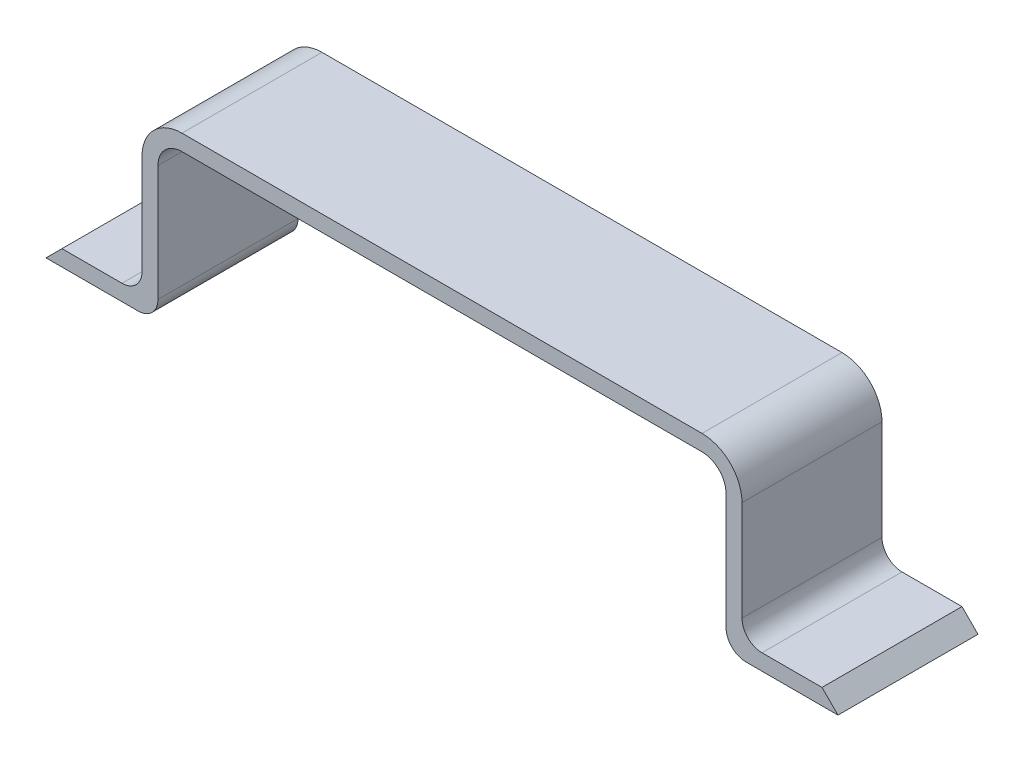
from build123d import *

# Parameters (mm, degrees)
BOSS_EXTRUDE1_DEPTH = 17.5
CHAMFER1_SIZE       = 5


with BuildPart() as part:
    # Sketch1 → Boss-Extrude1 (new, symmetric)
    with BuildSketch(Plane.XY):
        with BuildLine():
            Line((-100, 0), (-80, 0))
            ThreePointArc((-80, 0), (-76.464466094, 1.464466094), (-75, 5))
            Line((-75, 5), (-75, 30))
            ThreePointArc((-75, 30), (-72.071067812, 37.071067812), (-65, 40))
            Line((-65, 40), (65, 40))
            ThreePointArc((65, 40), (72.071067812, 37.071067812), (75, 30))
            Line((75, 30), (75, 5))
            ThreePointArc((75, 5), (76.464466094, 1.464466094), (80, 0))
            Line((80, 0), (100, 0))
            Line((100, 0), (100, -4))
            Line((100, -4), (76, -4))
            ThreePointArc((76, -4), (72.464466094, -2.535533906), (71, 1))
            Line((71, 1), (71, 30))
            ThreePointArc((71, 30), (69.242640687, 34.242640687), (65, 36))
            Line((65, 36), (-65, 36))
            ThreePointArc((-65, 36), (-69.242640687, 34.242640687), (-71, 30))
            Line((-71, 30), (-71, 1))
            ThreePointArc((-71, 1), (-72.464466094, -2.535533906), (-76, -4))
            Line((-76, -4), (-100, -4))
            Line((-100, -4), (-100, 0))
        make_face()
    extrude(amount=BOSS_EXTRUDE1_DEPTH, both=True)

    # Chamfer1
    # the kernel refuses this chamfer: 5 mm, written as the material it takes off along each edge
    with BuildSketch(Plane(origin=(-100, 0, 30.35841494), x_dir=(0.9996219169112968, 0.027495876610586334, 0), z_dir=(0, 0, -1)), Plane(origin=(100, 0, 30.35841494), x_dir=(0.0274958766105877, -0.9996219169112968, 0), z_dir=(0, 0, -1))) as chamfer1_piece_1:
        Polygon((CHAMFER1_SIZE * 0.999621916911, CHAMFER1_SIZE * 0.0274958766106), (-CHAMFER1_SIZE * 0.0274958766106, CHAMFER1_SIZE * 0.999621916911), (0, 0), align=None)
    extrude(amount=60.71682988, mode=Mode.SUBTRACT)


solid = part.part
